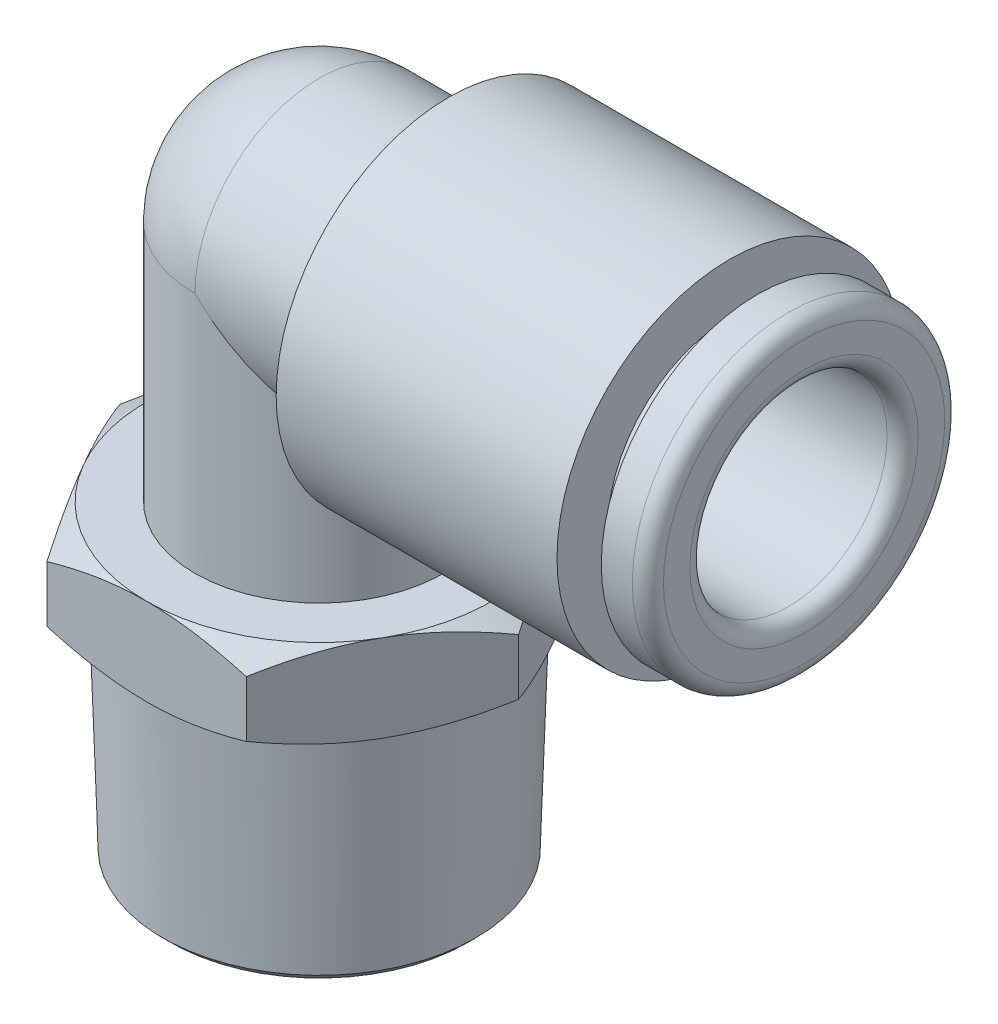
from build123d import *

# Parameters (mm, degrees)
SKETCH1_R             = 4
BASE_EXTRUDE_DEPTH    = 3.6
RBODY_SKETCH_R        = 5.55
RBODY_DEPTH           = 9.6
ELBOW_ANGLE           = 90
SKETCH3_R             = 4
BOSS_EXTRUDE1_DEPTH   = 7.8
NUT_DEPTH             = 2.8
RTUBE_START           = -13.3
RTUBE_SKETCH_R        = 3.175
RTUBE_DEPTH           = 13.3
RTUBE_RADIUS_R        = 0.5
DIAMETER_R            = 1.5875
SKETCH4_W             = 3.5
SKETCH4_H             = 3.95
PORT_THREADS_REACH    = 30.544
PORT_THREADS_SKETCH_R = 1.5875


with BuildPart() as part:
    # Sketch1 → Base-Extrude (new body)
    with BuildSketch(Plane(origin=(0, 0, 0), x_dir=(0, 0, -1), z_dir=(1, 0, 0))):
        with Locations(Location((0, 0, 0), (0, 0, 180))):
            Circle(SKETCH1_R)
    extrude(amount=BASE_EXTRUDE_DEPTH)

    # RBody_Sketch → RBody (add)
    with BuildSketch(Plane(origin=(3.6, 0, 0), x_dir=(0, 0, -1), z_dir=(1, 0, 0))):
        Circle(RBODY_SKETCH_R)
    extrude(amount=RBODY_DEPTH)

    # RBody_Chamfer: read off the stored shape, not the designer's step
    # RBody_Chamfer outline → RBody_Chamfer (revolve, cut)
    with BuildSketch(Plane.YX):
        Polygon((5.55, 4.164153863), (4, 3.6), (5.55, 3.6), align=None)
    revolve(axis=Axis((0, 0, 0), (1, 0, 0)), mode=Mode.SUBTRACT)

    # RRelease_Sketch → RRelease (revolve)
    with BuildSketch(Plane.XY, mode=Mode.PRIVATE) as rrelease_sk:
        with BuildLine():
            Line((13.2, 3.925), (14.1, 3.925))
            Line((14.1, 3.925), (14.1, 5.025))
            Line((14.1, 5.025), (15.1, 5.025))
            ThreePointArc((15.1, 5.025), (15.453553391, 4.878553391), (15.6, 4.525))
            Line((15.6, 4.525), (15.6, 0))
            Line((15.6, 0), (13.2, 0))
            Line((13.2, 0), (13.2, 3.925))
        make_face()
    revolve(rrelease_sk.sketch.rotate(Axis((12.597722381, 0, 0), (1, 0, 0)), 90), axis=Axis((12.597722381, 0, 0), (1, 0, 0)))

    # Elbow_Sketch → Elbow (revolve)
    with BuildSketch(Plane.ZY):
        with BuildLine():
            Line((-4, 0), (4, 0))
            ThreePointArc((4, 0), (0, 4), (-4, 0))
        make_face()
    revolve(axis=Axis((0, 0, -6.487672297), (0, 0, 1)), revolution_arc=ELBOW_ANGLE)

    # Sketch3 → Boss-Extrude1 (add)
    with BuildSketch(Plane.XZ):
        with Locations(Location((0, 0, 0), (0, 0, 90))):
            Circle(SKETCH3_R)
    extrude(amount=BOSS_EXTRUDE1_DEPTH)

    # Nut_Sketch → Nut (add)
    with BuildSketch(Plane(origin=(0, -10.6, 0), x_dir=(-1, 0, 0), z_dir=(0, 1, 0))):
        Polygon((6.414361491, 0), (3.207180745, 5.555), (-3.207180745, 5.555), (-6.414361491, 0), (-3.207180745, -5.555), (3.207180745, -5.555), align=None)
    extrude(amount=NUT_DEPTH)

    # Nut_Chamfer_Sketch → Nut_Chamfer (revolve, cut)
    with BuildSketch(Plane.XY):
        Polygon((-5.555, -7.8), (-6.414361491, -7.8), (-6.414361491, -8.296152588), align=None)
        Polygon((-6.414361491, -10.103847412), (-5.555, -10.6), (-6.414361491, -10.6), align=None)
    revolve(axis=Axis((0, -1.551633987, 0), (0, 1, 0)), mode=Mode.SUBTRACT)

    # Threads_Sketch → Threads (revolve)
    with BuildSketch(Plane.XY):
        Polygon((-5.247489296, -10.6), (-5.026347442, -17.7), (0, -17.7), (0, -10.6), align=None)
    revolve(axis=Axis((0, 0, 0), (0, -1, 0)))

    # Thread_Chamfer: read off the stored shape, not the designer's step
    # Thread_Chamfer outline → Thread_Chamfer (revolve, cut)
    with BuildSketch(Plane.XY):
        Polygon((5.034384454, -17.441962988), (4.776347442, -17.7), (5.034384454, -17.7), align=None)
    revolve(axis=Axis((0, 0, 0), (0, 1, 0)), mode=Mode.SUBTRACT)

    # RTube_Sketch → RTube (cut)
    with BuildSketch(Plane(origin=(15.6, 0, 0), x_dir=(0, 0, -1), z_dir=(1, 0, 0)).offset(RTUBE_START)):
        Circle(RTUBE_SKETCH_R)
    extrude(amount=RTUBE_DEPTH, mode=Mode.SUBTRACT)

    # RTube_Radius
    rtube_radius_edges = [part.edges().sort_by_distance(p)[0] for p in [
        (15.6, 0, 3.175),
    ]]
    fillet(rtube_radius_edges, radius=RTUBE_RADIUS_R)

    # Port_Curve: sweep along a path in Profile
    with BuildLine(Plane.XY) as port_curve_path:
        ThreePointArc((2.3, 0), (0.673654403, -0.673654403), (0, -2.3))
    # Diameter → Port_Curve (sweep, cut)
    with BuildSketch(Plane(origin=(2.3, 0, 0), x_dir=(0, 0, -1), z_dir=(1, 0, 0))):
        Circle(DIAMETER_R)
    sweep(path=port_curve_path.line, mode=Mode.SUBTRACT)

    # Sketch4 → Revolve1 (revolve)
    with BuildSketch(Plane.XY):
        with Locations((-1.75, -12.575)):
            Rectangle(SKETCH4_W, SKETCH4_H)
    revolve(axis=Axis((0, 0, 0), (0, -1, 0)))

    # Port_Threads_Sketch → Port_Threads (cut, up to next)
    with BuildSketch(Plane(origin=(0, -17.7, 0), x_dir=(-1, 0, 0), z_dir=(0, 1, 0)), mode=Mode.PRIVATE) as port_threads_sk1:
        Circle(PORT_THREADS_SKETCH_R)
    port_threads_tool1 = extrude(port_threads_sk1.sketch, amount=PORT_THREADS_REACH, mode=Mode.PRIVATE) & part.part
    add(port_threads_tool1.solids().sort_by_distance((0, -17.7, 0))[0], mode=Mode.SUBTRACT)


solid = part.part
